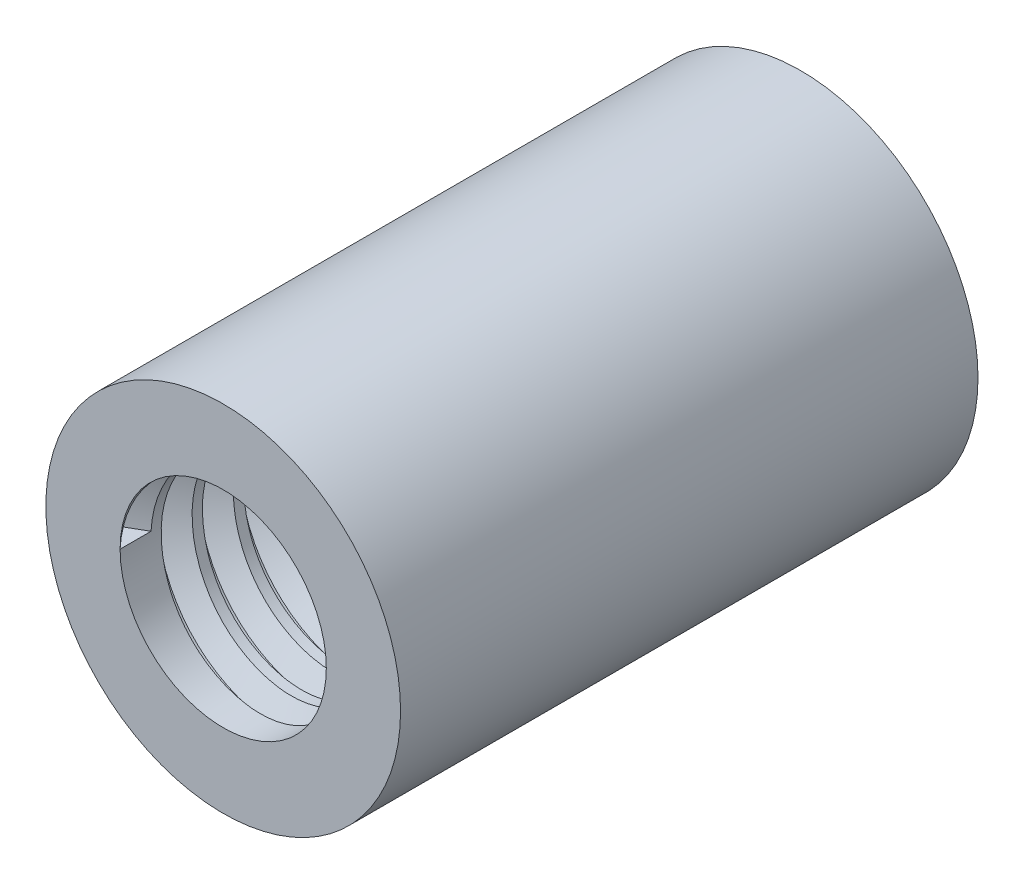
from build123d import *

# Parameters (mm, degrees)
IZIM1_R                     = 2.15
IZIM1_R_2                   = 1.25
Y_KSEKLIK_EKSTR_ZYON1_DEPTH = 7
DI_1_PITCH                  = 0.5


with BuildPart() as part:
    # Çizim1 → Yükseklik-Ekstrüzyon1 (new body)
    with BuildSketch(Plane.XY):
        Circle(IZIM1_R)
        Circle(IZIM1_R_2, mode=Mode.SUBTRACT)
    extrude(amount=Y_KSEKLIK_EKSTR_ZYON1_DEPTH)

    # Diş1: the profile of Diş Profili1 profile screwed along a right-hand helix of 14 turns, 6 arcs to a turn; built about Z, then put on its axis
    di_1_z = Axis((0, 0, 0), (0, 0, 1))
    di_1_corners = [(1.2497, 0, -0.000173205), (1.520632938, 0, 0.156249999), (1.520632937, 0, 0.218749999), (1.2497, 0, 0.375173204)]
    with BuildLine(mode=Mode.PRIVATE) as di_1_profile:
        Line(di_1_corners[0], di_1_corners[1])
        Line(di_1_corners[1], di_1_corners[2])
        Line(di_1_corners[2], di_1_corners[3])
        Line(di_1_corners[3], di_1_corners[0])
    di_1_cap = Face(di_1_profile.wire())
    di_1_turn_angles = [0, 30, 60, 90, 120, 150, 180, 210, 240, 270, 300, 330, 360]
    di_1_turn_weights = [1, 0.8660254037844387, 1, 0.8660254037844387, 1, 0.8660254037844387, 1, 0.8660254037844387, 1, 0.8660254037844387, 1, 0.8660254037844387, 1]
    di_1_turn_rails = [Edge.make_bspline([Vector(p[0], p[1], 0).rotate(di_1_z, di_1_turn_angles[k]) / di_1_turn_weights[k] + Vector(0, 0, p[2] + DI_1_PITCH * di_1_turn_angles[k] / 360) for k in range(13)], [0, 0, 0, 1, 1, 2, 2, 3, 3, 4, 4, 5, 5, 6, 6, 6], 2, di_1_turn_weights) for p in di_1_corners]
    di_1_turn_sides = [Face.make_surface_from_curves(di_1_turn_rails[p[0]], di_1_turn_rails[p[1]]) for p in [(0, 1), (1, 2), (2, 3), (3, 0)]]
    di_1 = Plane(origin=(0, 0, 7), x_dir=(-1, 0, 0), z_dir=(0, 0, -1)) * Solid(Shell([*[p.moved(Location((0, 0, DI_1_PITCH * i))) for i in range(14) for p in di_1_turn_sides], di_1_cap, di_1_cap.rotate(di_1_z, 5040).moved(Location((0, 0, DI_1_PITCH * 5040 / 360)))]))
    add(di_1, mode=Mode.SUBTRACT)


solid = part.part
